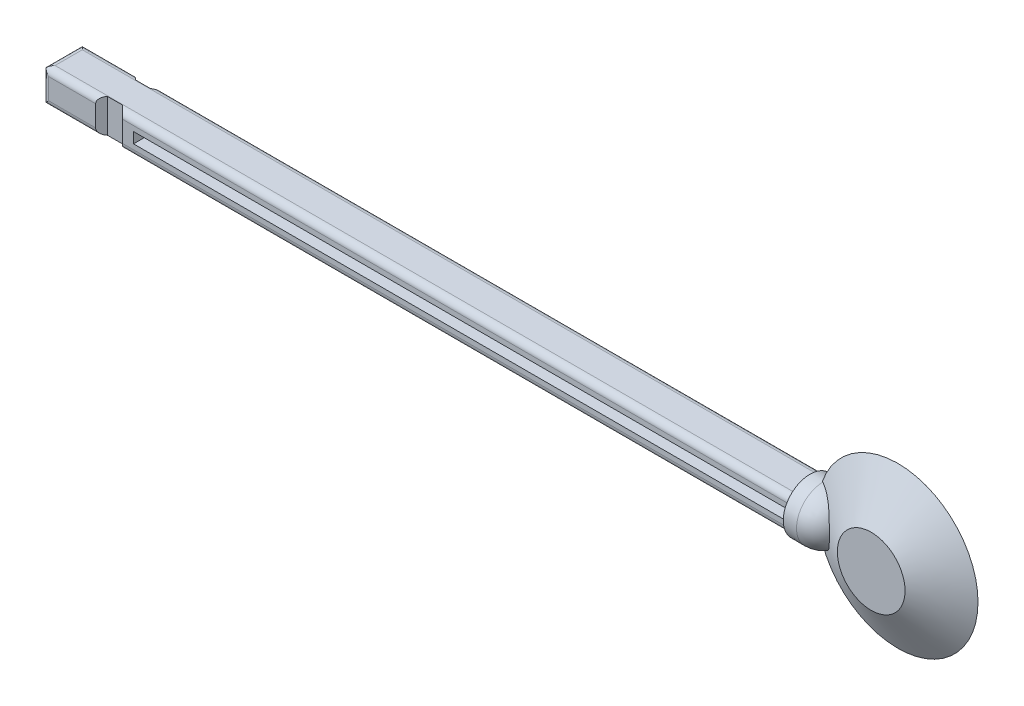
from build123d import *

# Parameters (mm, degrees)
SKETCH2_R                     = 9.525
BOSS_EXTRUDE1_DEPTH           = 3.175
BOSS_EXTRUDE1_TAPER           = 60
BOSS_EXTRUDE1_OTHER_WAY_DEPTH = 3.175
BOSS_EXTRUDE1_OTHER_WAY_TAPER = 60
BOSS_EXTRUDE2_DEPTH           = 2.38125
CUT_EXTRUDE1_DEPTH            = 90.465522276
CUT_EXTRUDE1_DEPTH_BACK       = 90.465522276
SKETCH5_W                     = 78.047666622
SKETCH5_H                     = 1.27
CUT_EXTRUDE2_DEPTH            = 1.27
SKETCH6_W                     = 78.047666622
SKETCH6_H                     = 1.27
CUT_EXTRUDE3_DEPTH            = 1.27
FILLET1_START                 = -88.9
FILLET1_DEPTH                 = 88.9
FILLET1_START_2               = -2.38125
FILLET1_2_DEPTH               = 4.7625
FILLET1_START_3               = -2.006559914
FILLET1_3_DEPTH               = 4.013119828


with BuildPart() as part:
    # Sketch1 → Revolve1 (revolve)
    with BuildSketch(Plane.XY, mode=Mode.PRIVATE) as revolve1_sk:
        with BuildLine():
            Line((0, 0), (0, 3.175))
            Line((0, 3.175), (1.587469063, 3.18491082))
            ThreePointArc((1.587469063, 3.18491082), (3.841885865, 2.257287955), (4.7625, 0))
            Line((4.7625, 0), (3.175, 0))
            Line((3.175, 0), (0, 0))
        make_face()
    revolve(revolve1_sk.sketch.rotate(Axis((-88.99, 0, 0), (1, 0, 0)), 90), axis=Axis((-88.99, 0, 0), (1, 0, 0)))

    # Sketch2 → Boss-Extrude1 (add)
    with BuildSketch(Plane.XY):
        with Locations((10.457777384, 0)):
            Circle(SKETCH2_R)
    extrude(amount=BOSS_EXTRUDE1_DEPTH, taper=BOSS_EXTRUDE1_TAPER)

    # Sketch2 → Boss-Extrude1 other way (add)
    with BuildSketch(Plane.XY):
        with Locations((10.457777384, 0)):
            Circle(SKETCH2_R)
    extrude(amount=-BOSS_EXTRUDE1_OTHER_WAY_DEPTH, taper=BOSS_EXTRUDE1_OTHER_WAY_TAPER)

    # Sketch3 → Boss-Extrude2 (add, symmetric)
    with BuildSketch(Plane.XY):
        Polygon((0, 2.006559914), (-88.9, 2.006559914), (-88.9, 0), (-88.9, -2.006559914), (0, -2.006559914), (0, 0), align=None)
    extrude(amount=BOSS_EXTRUDE2_DEPTH, both=True)

    # Sketch4 → Cut-Extrude1 (cut, two sides: drawn at the far end of the back side and taken through both)
    with BuildSketch(Plane(origin=(0, 0, 0), x_dir=(1, 0, 0), z_dir=(0, 1, 0)).offset(-CUT_EXTRUDE1_DEPTH_BACK)):
        Polygon((-82.55, 2.38125), (-81.847582607, 1.678832607), (-80.077417393, 1.678832607), (-79.375, 2.38125), align=None)
        Polygon((-80.077417393, -1.678832607), (-79.375, -2.38125), (-82.55, -2.38125), (-81.847582607, -1.678832607), align=None)
    extrude(amount=CUT_EXTRUDE1_DEPTH + CUT_EXTRUDE1_DEPTH_BACK, mode=Mode.SUBTRACT)

    # Sketch5 → Cut-Extrude2 (cut)
    with BuildSketch(Plane.XY.offset(2.38125)):
        with Locations((-39.023833311, 0)):
            Rectangle(SKETCH5_W, SKETCH5_H)
    extrude(amount=-CUT_EXTRUDE2_DEPTH, mode=Mode.SUBTRACT)

    # Sketch6 → Cut-Extrude3 (cut)
    with BuildSketch(Plane(origin=(0, 0, -2.38125), x_dir=(-1, 0, 0), z_dir=(0, 0, -1))):
        with Locations((39.023833311, 0)):
            Rectangle(SKETCH6_W, SKETCH6_H)
    extrude(amount=-CUT_EXTRUDE3_DEPTH, mode=Mode.SUBTRACT)

    # Fillet1: read off the stored shape, not the designer's step
    # Fillet1 outline → Fillet1 (cut)
    with BuildSketch(Plane.YZ.offset(FILLET1_START)):
        with BuildLine():
            Line((-2.006559914, 2.38125), (-2.006559914, 1.61925))
            ThreePointArc((-2.006559914, 1.61925), (-1.783375281, 2.158065367), (-1.244559914, 2.38125))
            Line((-1.244559914, 2.38125), (-2.006559914, 2.38125))
        make_face()
        with BuildLine():
            ThreePointArc((-1.244559914, -2.38125), (-1.783375281, -2.158065367), (-2.006559914, -1.61925))
            Line((-2.006559914, -1.61925), (-2.006559914, -2.38125))
            Line((-2.006559914, -2.38125), (-1.244559914, -2.38125))
        make_face()
        with BuildLine():
            Line((2.006559914, 2.38125), (1.244559914, 2.38125))
            ThreePointArc((1.244559914, 2.38125), (1.783375281, 2.158065367), (2.006559914, 1.61925))
            Line((2.006559914, 1.61925), (2.006559914, 2.38125))
        make_face()
        with BuildLine():
            ThreePointArc((2.006559914, -1.61925), (1.783375281, -2.158065367), (1.244559914, -2.38125))
            Line((1.244559914, -2.38125), (2.006559914, -2.38125))
            Line((2.006559914, -2.38125), (2.006559914, -1.61925))
        make_face()
    extrude(amount=FILLET1_DEPTH, mode=Mode.SUBTRACT)

    # Fillet1 2 outline → Fillet1 2 (cut)
    with BuildSketch(Plane.XY.offset(FILLET1_START_2)):
        with BuildLine():
            Line((-88.9, -2.006559914), (-88.138, -2.006559914))
            ThreePointArc((-88.138, -2.006559914), (-88.676815367, -1.783375281), (-88.9, -1.244559914))
            Line((-88.9, -1.244559914), (-88.9, -2.006559914))
        make_face()
        with BuildLine():
            Line((-88.9, 2.006559914), (-88.9, 1.244559914))
            ThreePointArc((-88.9, 1.244559914), (-88.676815367, 1.783375281), (-88.138, 2.006559914))
            Line((-88.138, 2.006559914), (-88.9, 2.006559914))
        make_face()
    extrude(amount=FILLET1_2_DEPTH, mode=Mode.SUBTRACT)

    # Fillet1 3 outline → Fillet1 3 (cut)
    with BuildSketch(Plane(origin=(0, 0, 0), x_dir=(1, 0, 0), z_dir=(0, 1, 0)).offset(FILLET1_START_3)):
        with BuildLine():
            ThreePointArc((-88.138, -2.38125), (-88.676815367, -2.158065367), (-88.9, -1.61925))
            Line((-88.9, -1.61925), (-88.9, -2.38125))
            Line((-88.9, -2.38125), (-88.138, -2.38125))
        make_face()
        with BuildLine():
            Line((-88.9, 2.38125), (-88.9, 1.61925))
            ThreePointArc((-88.9, 1.61925), (-88.676815367, 2.158065367), (-88.138, 2.38125))
            Line((-88.138, 2.38125), (-88.9, 2.38125))
        make_face()
    extrude(amount=FILLET1_3_DEPTH, mode=Mode.SUBTRACT)


solid = part.part
